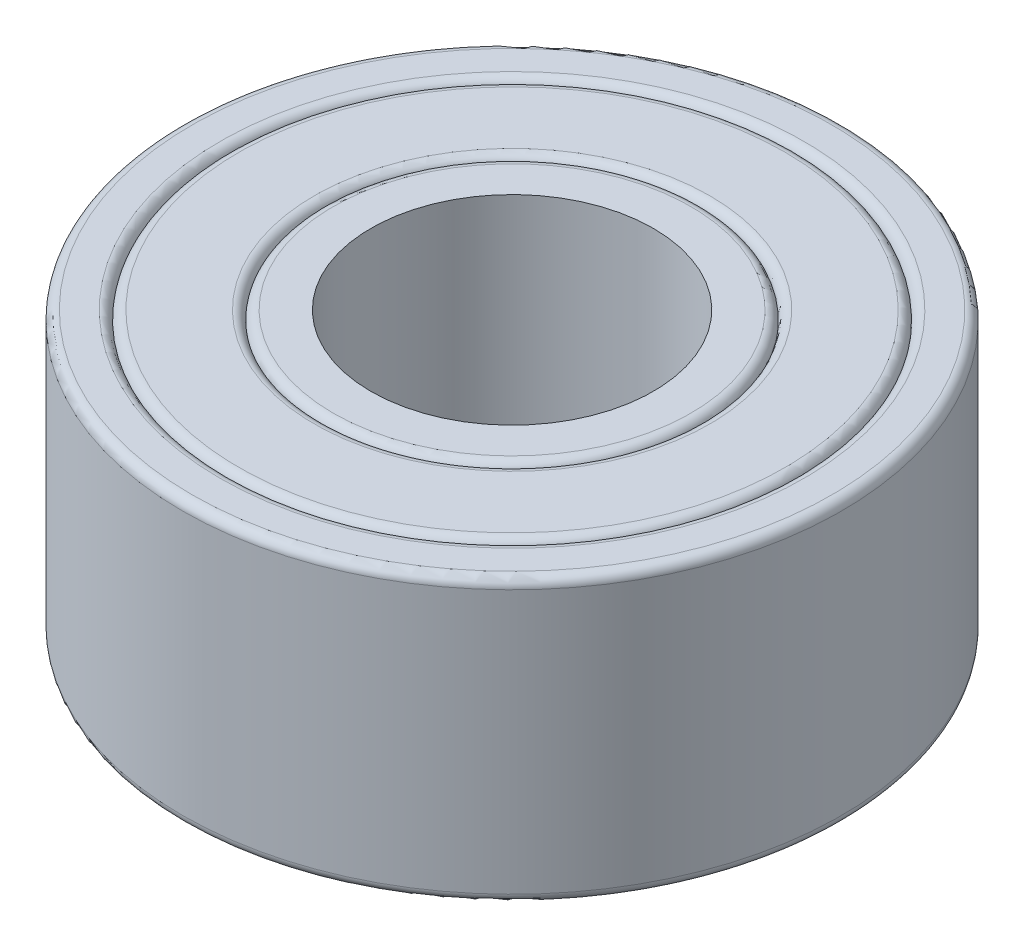
from build123d import *

# Parameters (mm, degrees)
SKETCH1_R           = 2
SKETCH1_R_2         = 1.5
BOSS_EXTRUDE1_DEPTH = 3
FILLET1_R           = 0.1
SKETCH2_R           = 3
SKETCH2_R_2         = 2
BOSS_EXTRUDE2_DEPTH = 3
FILLET2_R           = 0.1
FILLET3_R           = 0.1
BOSS_EXTRUDE3_START = -3
SKETCH3_R           = 3.5
SKETCH3_R_2         = 3
BOSS_EXTRUDE3_DEPTH = 3
FILLET4_R           = 0.1


# Some blends are built 0.0001 mm under size
with BuildPart() as part:
    # Sketch1 → Boss-Extrude1 (new body)
    with BuildSketch(Plane(origin=(0, 0, 0), x_dir=(1, 0, 0), z_dir=(0, 1, 0))):
        with Locations(Location((0, 0, 0), (0, 0, 270))):
            Circle(SKETCH1_R)
        with Locations(Location((0, 0, 0), (0, 0, 270))):
            Circle(SKETCH1_R_2, mode=Mode.SUBTRACT)
    extrude(amount=BOSS_EXTRUDE1_DEPTH)

    # Fillet1
    fillet1_edges = [part.edges().sort_by_distance(p)[0] for p in [
        (0, 0, -2),
        (0, 3, -2),
    ]]
    fillet(fillet1_edges, radius=FILLET1_R)

    # Sketch2 → Boss-Extrude2 (add)
    with BuildSketch(Plane.XZ):
        with Locations(Location((0, 0, 0), (0, 0, 270))):
            Circle(SKETCH2_R)
        with Locations(Location((0, 0, 0), (0, 0, 270))):
            Circle(SKETCH2_R_2, mode=Mode.SUBTRACT)
    extrude(amount=-BOSS_EXTRUDE2_DEPTH)

    # Fillet2
    fillet2_edges = [part.edges().sort_by_distance(p)[0] for p in [
        (0, 0, 2),
        (0, 0, 3),
    ]]
    fillet(fillet2_edges, radius=FILLET2_R - 0.0001)  # a hair under: the kernel refuses the full size

    # Fillet3
    fillet3_edges = [part.edges().sort_by_distance(p)[0] for p in [
        (0, 3, 3),
        (0, 3, 2),
    ]]
    fillet(fillet3_edges, radius=FILLET3_R - 0.0001)  # a hair under: the kernel refuses the full size

    # Sketch3 → Boss-Extrude3 (add)
    with BuildSketch(Plane(origin=(0, 3, 0), x_dir=(1, 0, 0), z_dir=(0, 1, 0)).offset(BOSS_EXTRUDE3_START)):
        with Locations(Location((0, 0, 0), (0, 0, 270))):
            Circle(SKETCH3_R)
        with Locations(Location((0, 0, 0), (0, 0, 270))):
            Circle(SKETCH3_R_2, mode=Mode.SUBTRACT)
    extrude(amount=BOSS_EXTRUDE3_DEPTH)

    # Fillet4
    # the kernel refuses this fillet: 0.1 mm, written as the material it takes off along each edge
    with BuildSketch(Plane(origin=(0, 3, 0), x_dir=(0, 0, 1), z_dir=(-1, 0, 0))) as fillet4_piece_1:
        with BuildLine():
            CenterArc((3.09999995, -0.1), FILLET4_R, 90, 89.942704211)
            Line((3.09999995, 0), (3, 0))
            Line((3, 0), (3, -0.0999))
        make_face()
    revolve(axis=Axis((0, 3, 0), (0, 1, 0)), revolution_arc=179.999997988, mode=Mode.SUBTRACT)
    with BuildSketch(Plane(origin=(0, 3, 0), x_dir=(3.511003429742081e-08, 0, -0.9999999999999994), z_dir=(0.9999999999999994, 0, 3.511003429742081e-08))) as fillet4_piece_2:
        with BuildLine():
            CenterArc((3.09999995, -0.1), FILLET4_R, 90, 89.942704211)
            Line((3.09999995, 0), (3, 0))
            Line((3, 0), (3, -0.0999))
        make_face()
    revolve(axis=Axis((0, 3, 0), (0, 1, 0)), revolution_arc=180.000002012, mode=Mode.SUBTRACT)
    with BuildSketch(Plane(origin=(0, 0, 0), x_dir=(0, 0, 1), z_dir=(-1, 0, 0))) as fillet4_piece_3:
        with BuildLine():
            CenterArc((3.5 - FILLET4_R, FILLET4_R), FILLET4_R, 270, 90)
            Line((3.5 - FILLET4_R, 0), (3.5, 0))
            Line((3.5, 0), (3.5, FILLET4_R))
        make_face()
    revolve(axis=Axis((0, 0, 0), (0, 1, 0)), mode=Mode.SUBTRACT)
    with BuildSketch(Plane(origin=(0, 0, 0), x_dir=(0, 0, 1), z_dir=(-1, 0, 0))) as fillet4_piece_4:
        with BuildLine():
            CenterArc((3.09999995, 0.1), FILLET4_R, 180.057295789, 89.942704211)
            Line((3, 0.0999), (3, 0))
            Line((3, 0), (3.09999995, 0))
        make_face()
    revolve(axis=Axis((0, 0, 0), (0, 1, 0)), revolution_arc=179.999997988, mode=Mode.SUBTRACT)
    with BuildSketch(Plane(origin=(0, 0, 0), x_dir=(3.511003429742081e-08, 0, -0.9999999999999994), z_dir=(0.9999999999999994, 0, 3.511003429742081e-08))) as fillet4_piece_5:
        with BuildLine():
            CenterArc((3.09999995, 0.1), FILLET4_R, 180.057295789, 89.942704211)
            Line((3, 0.0999), (3, 0))
            Line((3, 0), (3.09999995, 0))
        make_face()
    revolve(axis=Axis((0, 0, 0), (0, 1, 0)), revolution_arc=180.000002012, mode=Mode.SUBTRACT)
    with BuildSketch(Plane(origin=(0, 3, 0), x_dir=(0, 0, 1), z_dir=(-1, 0, 0))) as fillet4_piece_6:
        with BuildLine():
            CenterArc((3.5 - FILLET4_R, -FILLET4_R), FILLET4_R, 0, 90)
            Line((3.5, -FILLET4_R), (3.5, 0))
            Line((3.5, 0), (3.5 - FILLET4_R, 0))
        make_face()
    revolve(axis=Axis((0, 3, 0), (0, 1, 0)), mode=Mode.SUBTRACT)


solid = part.part
